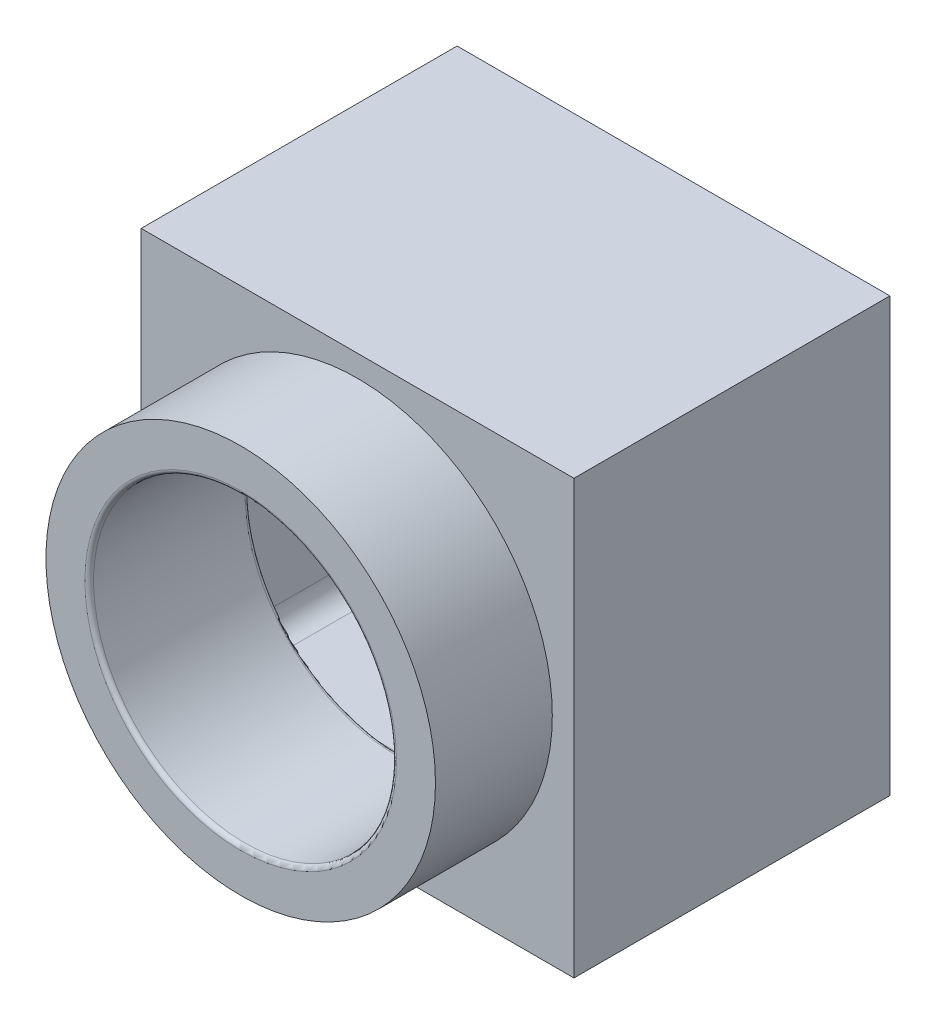
from build123d import *

# Parameters (mm, degrees)
SKETCH1_W               = 25.4
SKETCH1_H               = 25.4
BOSS_EXTRUDE1_DEPTH     = 25.4
SKETCH2_W               = 22.4536
SKETCH2_H               = 20.447
CUT_EXTRUDE1_DEPTH      = 25.055020349
CUT_EXTRUDE2_DEPTH      = 32.108519733
CUT_EXTRUDE2_DEPTH_BACK = 32.108519733
SKETCH3_R               = 8.89
SKETCH4_R               = 63.5
SKETCH4_R_2             = 11.43
CUT_EXTRUDE3_DEPTH      = 26.814448745
FILLET1_R               = 1.27
FILLET2_R               = 1.27
FILLET3_R               = 0.254


with BuildPart() as part:
    # Sketch1 → Boss-Extrude1 (new body)
    with BuildSketch(Plane.XY):
        Rectangle(SKETCH1_W, SKETCH1_H)
    extrude(amount=-BOSS_EXTRUDE1_DEPTH)

    # Sketch2 → Cut-Extrude1 (cut, through all)
    with BuildSketch(Plane.XY.offset(-9.398)):
        Rectangle(SKETCH2_W, SKETCH2_H)
    extrude(amount=-CUT_EXTRUDE1_DEPTH, mode=Mode.SUBTRACT)

    # Sketch3 → Cut-Extrude2 (cut, two sides: drawn at the far end of the back side and taken through both)
    with BuildSketch(Plane.XY.offset(-CUT_EXTRUDE2_DEPTH_BACK)):
        Circle(SKETCH3_R)
    extrude(amount=CUT_EXTRUDE2_DEPTH + CUT_EXTRUDE2_DEPTH_BACK, mode=Mode.SUBTRACT)

    # Sketch4 → Cut-Extrude3 (cut, through all)
    with BuildSketch(Plane.XY.offset(-6.858)):
        Circle(SKETCH4_R)
        Circle(SKETCH4_R_2, mode=Mode.SUBTRACT)
    extrude(amount=CUT_EXTRUDE3_DEPTH, mode=Mode.SUBTRACT)

    # Fillet1
    fillet1_edges = [part.edges().sort_by_distance(p)[0] for p in [
        (-11.2268, 0, -9.398),
        (0, -10.2235, -9.398),
        (11.2268, 0, -9.398),
        (0, 10.2235, -9.398),
    ]]
    fillet(fillet1_edges, radius=FILLET1_R)

    # Fillet2
    # the kernel refuses this fillet: 1.27 mm, written as the material it adds along each edge
    with BuildSketch(Plane(origin=(-9.9568, 8.9535, -10.668), x_dir=(-1, 0, 0), z_dir=(0, 1, 0))) as fillet2_piece_1_section:
        Polygon((0, 0), (FILLET2_R, 0), (FILLET2_R, FILLET2_R), (0, FILLET2_R), align=None)
    fillet2_piece_1 = extrude(amount=FILLET2_R, mode=Mode.PRIVATE)
    fillet2_piece_1 = fillet2_piece_1 - Plane(origin=(-9.9568, 8.9535, -10.668), x_dir=(0.7071067811865475, 0, -0.7071067811865475), z_dir=(0, 1, 0)) * Sphere(FILLET2_R, mode=Mode.PRIVATE)
    add(fillet2_piece_1)
    with BuildSketch(Plane(origin=(9.9568, 8.9535, -10.668), x_dir=(0, 1, 0), z_dir=(1, 0, 0))) as fillet2_piece_2_section:
        Polygon((0, 0), (FILLET2_R, 0), (FILLET2_R, FILLET2_R), (0, FILLET2_R), align=None)
    fillet2_piece_2 = extrude(amount=FILLET2_R, mode=Mode.PRIVATE)
    fillet2_piece_2 = fillet2_piece_2 - Plane(origin=(9.9568, 8.9535, -10.668), x_dir=(0, -0.7071067811865475, -0.7071067811865475), z_dir=(1, 0, 0)) * Sphere(FILLET2_R, mode=Mode.PRIVATE)
    add(fillet2_piece_2)
    with BuildSketch(Plane(origin=(-9.9568, -8.9535, -10.668), x_dir=(-1, 0, 0), z_dir=(0, -1, 0))) as fillet2_piece_3_section:
        Polygon((0, 0), (FILLET2_R, 0), (FILLET2_R, -FILLET2_R), (0, -FILLET2_R), align=None)
    fillet2_piece_3 = extrude(amount=FILLET2_R, mode=Mode.PRIVATE)
    fillet2_piece_3 = fillet2_piece_3 - Plane(origin=(-9.9568, -8.9535, -10.668), x_dir=(0.7071067811865475, 0, -0.7071067811865475), z_dir=(0, -1, 0)) * Sphere(FILLET2_R, mode=Mode.PRIVATE)
    add(fillet2_piece_3)
    with BuildSketch(Plane(origin=(9.9568, -8.9535, -10.668), x_dir=(0, -1, 0), z_dir=(1, 0, 0))) as fillet2_piece_4_section:
        Polygon((0, 0), (FILLET2_R, 0), (FILLET2_R, -FILLET2_R), (0, -FILLET2_R), align=None)
    fillet2_piece_4 = extrude(amount=FILLET2_R, mode=Mode.PRIVATE)
    fillet2_piece_4 = fillet2_piece_4 - Plane(origin=(9.9568, -8.9535, -10.668), x_dir=(0, 0.7071067811865475, -0.7071067811865475), z_dir=(1, 0, 0)) * Sphere(FILLET2_R, mode=Mode.PRIVATE)
    add(fillet2_piece_4)
    with BuildSketch(Plane(origin=(-11.2268, -10.2235, -10.668), x_dir=(1, 0, 0), z_dir=(0, 0, -1)), Plane(origin=(11.2268, -10.2235, -10.668), x_dir=(0, 1, 0), z_dir=(0, 0, -1))) as fillet2_piece_5:
        with BuildLine():
            CenterArc((FILLET2_R, -FILLET2_R), FILLET2_R, 90, 90)
            Line((0, -FILLET2_R), (0, 0))
            Line((0, 0), (FILLET2_R, 0))
        make_face()
    extrude(amount=14.732)
    with BuildSketch(Plane(origin=(-11.2268, 10.2235, -10.668), x_dir=(1, 0, 0), z_dir=(0, 0, -1)), Plane(origin=(11.2268, 10.2235, -10.668), x_dir=(0, -1, 0), z_dir=(0, 0, -1))) as fillet2_piece_6:
        with BuildLine():
            CenterArc((FILLET2_R, FILLET2_R), FILLET2_R, 180, 90)
            Line((0, FILLET2_R), (0, 0))
            Line((0, 0), (FILLET2_R, 0))
        make_face()
    extrude(amount=14.732)

    # Fillet3
    fillet3_edges = [part.edges().sort_by_distance(p)[0] for p in [
        (-8.89, 0, 0),
        (-8.89, 0, -9.398),
    ]]
    fillet(fillet3_edges, radius=FILLET3_R)


solid = part.part
